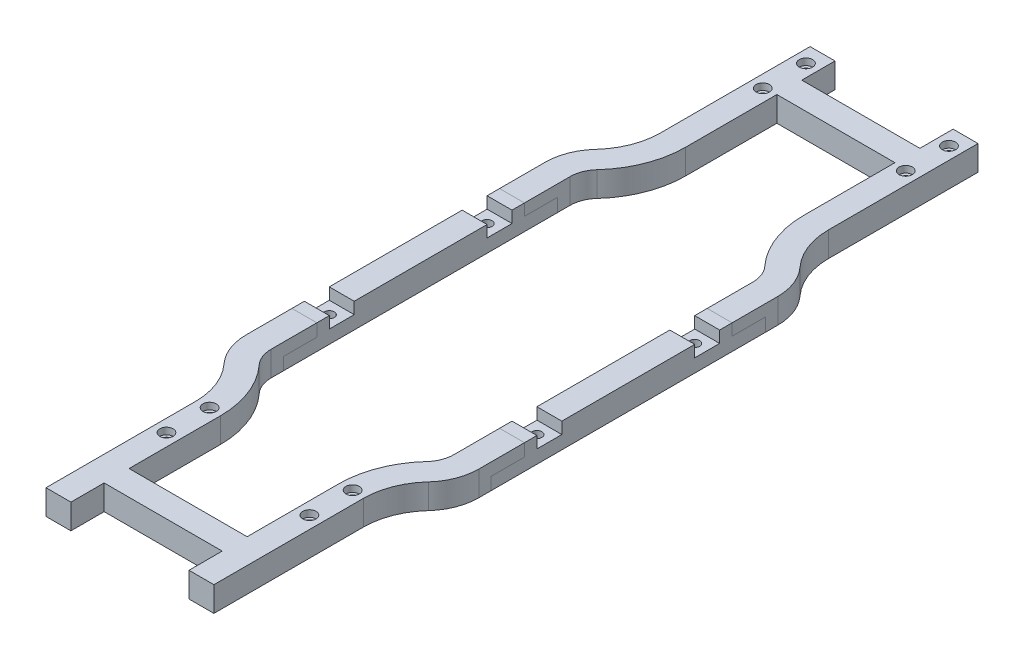
from build123d import *

# Parameters (mm, degrees)
SKETCH1_W                                  = 35.541770457
SKETCH1_H                                  = 15
BOSS_EXTRUDE1_DEPTH                        = 15
MIRROR2_AT_THE_SECOND_PLANE_COPY_1_SKETC_W = 35.541770457
MIRROR2_AT_THE_SECOND_PLANE_COPY_1_SKETC_H = 15
MIRROR2_AT_THE_SECOND_PLANE_COPY_1_DEPTH   = 15
CBORE_FOR_M4_SHCS1_D                       = 4.5
CBORE_FOR_M4_SHCS1_CBORE_D                 = 8
CBORE_FOR_M4_SHCS1_CBORE_DEPTH             = 4
SKETCH7_W                                  = 15
SKETCH7_H                                  = 15
CUT_EXTRUDE1_DEPTH                         = 7
SKETCH8_R                                  = 3
CUT_EXTRUDE2_DEPTH                         = 241.549371232
SPLIT1_START                               = -62.5
SPLIT1_OUTLINE_W                           = 140
SPLIT1_OUTLINE_H                           = 15
SPLIT1_DEPTH                               = 292.5
SPLIT1_START_2                             = -82.5
SPLIT1_2_OUTLINE_W                         = 15
SPLIT1_2_OUTLINE_H                         = 8
SPLIT1_2_DEPTH                             = 20
SPLIT1_3_OUTLINE_W                         = 15
SPLIT1_3_OUTLINE_H                         = 7.5
SPLIT1_3_OUTLINE_H_2                       = 80
SPLIT1_3_DEPTH                             = 15
SPLIT1_4_OUTLINE_W                         = 15
SPLIT1_4_OUTLINE_H                         = 20
SPLIT1_4_OUTLINE_H_2                       = 15
SPLIT1_4_OUTLINE_R                         = 3
SPLIT1_4_DEPTH                             = 7.5
SPLIT1_START_3                             = 7.5
SPLIT1_5_OUTLINE_W                         = 15
SPLIT1_5_OUTLINE_H                         = 20
SPLIT1_5_OUTLINE_H_2                       = 15
SPLIT1_5_OUTLINE_R                         = 3
SPLIT1_5_DEPTH                             = 0.5
SPLIT1_6_OUTLINE_W                         = 15
SPLIT1_6_OUTLINE_H                         = 7.5
SPLIT1_6_OUTLINE_H_2                       = 80
SPLIT1_6_DEPTH                             = 15
SPLIT1_7_OUTLINE_W                         = 15
SPLIT1_7_OUTLINE_H                         = 20
SPLIT1_7_OUTLINE_H_2                       = 15
SPLIT1_7_OUTLINE_R                         = 3
SPLIT1_7_DEPTH                             = 7.5
SPLIT1_8_OUTLINE_W                         = 15
SPLIT1_8_OUTLINE_H                         = 20
SPLIT1_8_OUTLINE_H_2                       = 15
SPLIT1_8_OUTLINE_R                         = 3
SPLIT1_8_DEPTH                             = 0.5
SPLIT1_9_OUTLINE_R                         = 4
SPLIT1_9_DEPTH                             = 15
SPLIT1_10_OUTLINE_W                        = 15
SPLIT1_10_OUTLINE_H                        = 20
SPLIT1_10_DEPTH                            = 7.5
SPLIT1_11_OUTLINE_R                        = 4
SPLIT1_11_OUTLINE_R_2                      = 2.25
SPLIT1_11_DEPTH                            = 11


# Read off the part's stored shape, not the designer's step: Split1
with BuildPart() as part:
    # Sketch1 → Boss-Extrude1 (new body)
    with BuildSketch(Plane(origin=(0, 0, 0), x_dir=(1, 0, 0), z_dir=(0, 1, 0))):
        with BuildLine():
            Line((-35.541770457, 230), (-35.541770457, 140))
            ThreePointArc((-35.541770457, 140), (-39.394799327, 119.475151066), (-50.429240982, 101.7450537))
            ThreePointArc((-50.429240982, 101.7450537), (-53.817041053, 96.301549897), (-55, 90))
            Line((-55, 90), (-55, 0))
            Line((-55, 0), (-70, 0))
            Line((-70, 0), (-70, 90))
            ThreePointArc((-70, 90), (-67.795808847, 101.741591346), (-61.48336752, 111.884397194))
            ThreePointArc((-61.48336752, 111.884397194), (-53.373567121, 124.915192515), (-50.541770457, 140))
            Line((-50.541770457, 140), (-50.541770457, 230))
            Line((-50.541770457, 230), (-35.541770457, 230))
        make_face()
        with Locations((-17.770885229, 202.5)):
            Rectangle(SKETCH1_W, SKETCH1_H)
    boss_extrude1 = extrude(amount=BOSS_EXTRUDE1_DEPTH)

    # Mirror2 at the second plane: Boss-Extrude1 across plane
    add(boss_extrude1.mirror(Plane.XY))



with BuildPart() as mirror2_1:
    # Mirror2: Boss-Extrude1 across plane
    add(boss_extrude1.mirror(Plane(origin=(0, 0, 0), x_dir=(0, 0, 1), z_dir=(1, 0, 0))))


with BuildPart() as part_1:
    add(part.part)

    add(mirror2_1.part)  # Mirror2 at the second plane copy 1 merges Mirror2_1
    # Mirror2 at the second plane copy 1 sketc → Mirror2 at the second plane copy 1 (add)
    with BuildSketch(Plane(origin=(0, 0, 0), x_dir=(-1, 0, 0), z_dir=(0, 1, 0))):
        with BuildLine():
            Line((-35.541770457, 230), (-35.541770457, 140))
            ThreePointArc((-35.541770457, 140), (-39.394799327, 119.475151066), (-50.429240982, 101.7450537))
            ThreePointArc((-50.429240982, 101.7450537), (-53.817041053, 96.301549897), (-55, 90))
            Line((-55, 90), (-55, 0))
            Line((-55, 0), (-70, 0))
            Line((-70, 0), (-70, 90))
            ThreePointArc((-70, 90), (-67.795808847, 101.741591346), (-61.48336752, 111.884397194))
            ThreePointArc((-61.48336752, 111.884397194), (-53.373567121, 124.915192515), (-50.541770457, 140))
            Line((-50.541770457, 140), (-50.541770457, 230))
            Line((-50.541770457, 230), (-35.541770457, 230))
        make_face()
        with Locations((-17.770885229, 202.5)):
            Rectangle(MIRROR2_AT_THE_SECOND_PLANE_COPY_1_SKETC_W, MIRROR2_AT_THE_SECOND_PLANE_COPY_1_SKETC_H)
    extrude(amount=MIRROR2_AT_THE_SECOND_PLANE_COPY_1_DEPTH)

    # CBORE for M4 SHCS1 (through all)
    with Locations(Plane(origin=(0, 15, 0), x_dir=(1, 0, 0), z_dir=(0, 1, 0))):
        with Locations((-43.041770457, 220), (-43.041770457, 194), (-43.041770457, -139), (-43.041770457, -165)):
            cbore_for_m4_shcs1 = CounterBoreHole(CBORE_FOR_M4_SHCS1_D / 2, CBORE_FOR_M4_SHCS1_CBORE_D / 2, CBORE_FOR_M4_SHCS1_CBORE_DEPTH)

    # Mirror3: CBORE for M4 SHCS1 across plane
    add(cbore_for_m4_shcs1.mirror(Plane(origin=(0, 0, 0), x_dir=(0, 0, 1), z_dir=(1, 0, 0))), mode=Mode.SUBTRACT)

    # Sketch7 → Cut-Extrude1 (cut)
    with BuildSketch(Plane(origin=(0, 15, 0), x_dir=(1, 0, 0), z_dir=(0, 1, 0))):
        with Locations((-62.5, 47.5)):
            Rectangle(SKETCH7_W, SKETCH7_H)
        with Locations((-62.5, -47.5)):
            Rectangle(SKETCH7_W, SKETCH7_H)
    cut_extrude1 = extrude(amount=-CUT_EXTRUDE1_DEPTH, mode=Mode.SUBTRACT)

    # Sketch8 → Cut-Extrude2 (cut, through all)
    with BuildSketch(Plane(origin=(0, 8, 0), x_dir=(1, 0, 0), z_dir=(0, 1, 0))):
        with Locations(Location((-62.5, 47.5, 0), (0, 0, 270))):
            Circle(SKETCH8_R)
        with Locations(Location((-62.5, -47.5, 0), (0, 0, 270))):
            Circle(SKETCH8_R)
    cut_extrude2 = extrude(amount=-CUT_EXTRUDE2_DEPTH, mode=Mode.SUBTRACT)

    # Mirror4: Cut-Extrude1, Cut-Extrude2 across plane
    add(cut_extrude1.mirror(Plane(origin=(0, 0, 0), x_dir=(0, 0, 1), z_dir=(1, 0, 0))), mode=Mode.SUBTRACT)
    add(cut_extrude2.mirror(Plane(origin=(0, 0, 0), x_dir=(0, 0, 1), z_dir=(1, 0, 0))), mode=Mode.SUBTRACT)

    # Split1 outline → Split1 (cut)
    with BuildSketch(Plane.XY.offset(SPLIT1_START)):
        with Locations((0, 7.5)):
            Rectangle(SPLIT1_OUTLINE_W, SPLIT1_OUTLINE_H)
    extrude(amount=SPLIT1_DEPTH, mode=Mode.SUBTRACT)

    # Split1 2 outline → Split1 2 (cut)
    with BuildSketch(Plane.XY.offset(SPLIT1_START_2)):
        with Locations((62.5, 4)):
            Rectangle(SPLIT1_2_OUTLINE_W, SPLIT1_2_OUTLINE_H)
        with Locations((-62.5, 4)):
            Rectangle(SPLIT1_2_OUTLINE_W, SPLIT1_2_OUTLINE_H)
    extrude(amount=SPLIT1_2_DEPTH, mode=Mode.SUBTRACT)


with BuildPart() as body_2:
    # Split1 3 outline → Split1 3 (new body)
    with BuildSketch(Plane(origin=(0, 0, 0), x_dir=(1, 0, 0), z_dir=(0, 1, 0))):
        with Locations((62.5, 58.75)):
            Rectangle(SPLIT1_3_OUTLINE_W, SPLIT1_3_OUTLINE_H)
        with Locations((62.5, 0)):
            Rectangle(SPLIT1_3_OUTLINE_W, SPLIT1_3_OUTLINE_H_2)
        with Locations((62.5, -58.75)):
            Rectangle(SPLIT1_3_OUTLINE_W, SPLIT1_3_OUTLINE_H)
    extrude(amount=SPLIT1_3_DEPTH)

    # Split1 4 outline → Split1 4 (add)
    # profile 1 of 4: a face of its own
    with BuildSketch(Plane(origin=(0, 0, 0), x_dir=(1, 0, 0), z_dir=(0, 1, 0))):
        with Locations((62.5, 72.5)):
            Rectangle(SPLIT1_4_OUTLINE_W, SPLIT1_4_OUTLINE_H)
    # profile 2 of 4: a face of its own
    with BuildSketch(Plane(origin=(0, 0, 0), x_dir=(1, 0, 0), z_dir=(0, 1, 0))):
        with Locations((62.5, 47.5)):
            Rectangle(SPLIT1_4_OUTLINE_W, SPLIT1_4_OUTLINE_H_2)
        with Locations((62.5, 47.5)):
            Circle(SPLIT1_4_OUTLINE_R, mode=Mode.SUBTRACT)
    # profile 3 of 4: a face of its own
    with BuildSketch(Plane(origin=(0, 0, 0), x_dir=(1, 0, 0), z_dir=(0, 1, 0))):
        with Locations((62.5, -47.5)):
            Rectangle(SPLIT1_4_OUTLINE_W, SPLIT1_4_OUTLINE_H_2)
        with Locations((62.5, -47.5)):
            Circle(SPLIT1_4_OUTLINE_R, mode=Mode.SUBTRACT)
    # profile 4 of 4: a face of its own
    with BuildSketch(Plane(origin=(0, 0, 0), x_dir=(1, 0, 0), z_dir=(0, 1, 0))):
        with Locations((62.5, -72.5)):
            Rectangle(SPLIT1_4_OUTLINE_W, SPLIT1_4_OUTLINE_H)
    extrude(amount=SPLIT1_4_DEPTH)

    # Split1 5 outline → Split1 5 (add)
    # profile 1 of 3: a face of its own
    with BuildSketch(Plane(origin=(0, 0, 0), x_dir=(1, 0, 0), z_dir=(0, 1, 0)).offset(SPLIT1_START_3)):
        with Locations((62.5, 72.5)):
            Rectangle(SPLIT1_5_OUTLINE_W, SPLIT1_5_OUTLINE_H)
    # profile 2 of 3: a face of its own
    with BuildSketch(Plane(origin=(0, 0, 0), x_dir=(1, 0, 0), z_dir=(0, 1, 0)).offset(SPLIT1_START_3)):
        with Locations((62.5, 47.5)):
            Rectangle(SPLIT1_5_OUTLINE_W, SPLIT1_5_OUTLINE_H_2)
        with Locations((62.5, 47.5)):
            Circle(SPLIT1_5_OUTLINE_R, mode=Mode.SUBTRACT)
    # profile 3 of 3: a face of its own
    with BuildSketch(Plane(origin=(0, 0, 0), x_dir=(1, 0, 0), z_dir=(0, 1, 0)).offset(SPLIT1_START_3)):
        with Locations((62.5, -47.5)):
            Rectangle(SPLIT1_5_OUTLINE_W, SPLIT1_5_OUTLINE_H_2)
        with Locations((62.5, -47.5)):
            Circle(SPLIT1_5_OUTLINE_R, mode=Mode.SUBTRACT)
    extrude(amount=SPLIT1_5_DEPTH)


with BuildPart() as body_3:
    # Split1 6 outline → Split1 6 (new body)
    with BuildSketch(Plane(origin=(0, 0, 0), x_dir=(1, 0, 0), z_dir=(0, 1, 0))):
        with Locations((-62.5, 58.75)):
            Rectangle(SPLIT1_6_OUTLINE_W, SPLIT1_6_OUTLINE_H)
        with Locations((-62.5, 0)):
            Rectangle(SPLIT1_6_OUTLINE_W, SPLIT1_6_OUTLINE_H_2)
        with Locations((-62.5, -58.75)):
            Rectangle(SPLIT1_6_OUTLINE_W, SPLIT1_6_OUTLINE_H)
    extrude(amount=SPLIT1_6_DEPTH)

    # Split1 7 outline → Split1 7 (add)
    # profile 1 of 4: a face of its own
    with BuildSketch(Plane(origin=(0, 0, 0), x_dir=(1, 0, 0), z_dir=(0, 1, 0))):
        with Locations((-62.5, 72.5)):
            Rectangle(SPLIT1_7_OUTLINE_W, SPLIT1_7_OUTLINE_H)
    # profile 2 of 4: a face of its own
    with BuildSketch(Plane(origin=(0, 0, 0), x_dir=(1, 0, 0), z_dir=(0, 1, 0))):
        with Locations((-62.5, 47.5)):
            Rectangle(SPLIT1_7_OUTLINE_W, SPLIT1_7_OUTLINE_H_2)
        with Locations((-62.5, 47.5)):
            Circle(SPLIT1_7_OUTLINE_R, mode=Mode.SUBTRACT)
    # profile 3 of 4: a face of its own
    with BuildSketch(Plane(origin=(0, 0, 0), x_dir=(1, 0, 0), z_dir=(0, 1, 0))):
        with Locations((-62.5, -47.5)):
            Rectangle(SPLIT1_7_OUTLINE_W, SPLIT1_7_OUTLINE_H_2)
        with Locations((-62.5, -47.5)):
            Circle(SPLIT1_7_OUTLINE_R, mode=Mode.SUBTRACT)
    # profile 4 of 4: a face of its own
    with BuildSketch(Plane(origin=(0, 0, 0), x_dir=(1, 0, 0), z_dir=(0, 1, 0))):
        with Locations((-62.5, -72.5)):
            Rectangle(SPLIT1_7_OUTLINE_W, SPLIT1_7_OUTLINE_H)
    extrude(amount=SPLIT1_7_DEPTH)

    # Split1 8 outline → Split1 8 (add)
    # profile 1 of 3: a face of its own
    with BuildSketch(Plane(origin=(0, 0, 0), x_dir=(1, 0, 0), z_dir=(0, 1, 0)).offset(SPLIT1_START_3)):
        with Locations((-62.5, 72.5)):
            Rectangle(SPLIT1_8_OUTLINE_W, SPLIT1_8_OUTLINE_H)
    # profile 2 of 3: a face of its own
    with BuildSketch(Plane(origin=(0, 0, 0), x_dir=(1, 0, 0), z_dir=(0, 1, 0)).offset(SPLIT1_START_3)):
        with Locations((-62.5, 47.5)):
            Rectangle(SPLIT1_8_OUTLINE_W, SPLIT1_8_OUTLINE_H_2)
        with Locations((-62.5, 47.5)):
            Circle(SPLIT1_8_OUTLINE_R, mode=Mode.SUBTRACT)
    # profile 3 of 3: a face of its own
    with BuildSketch(Plane(origin=(0, 0, 0), x_dir=(1, 0, 0), z_dir=(0, 1, 0)).offset(SPLIT1_START_3)):
        with Locations((-62.5, -47.5)):
            Rectangle(SPLIT1_8_OUTLINE_W, SPLIT1_8_OUTLINE_H_2)
        with Locations((-62.5, -47.5)):
            Circle(SPLIT1_8_OUTLINE_R, mode=Mode.SUBTRACT)
    extrude(amount=SPLIT1_8_DEPTH)


with BuildPart() as body_4:
    # Split1 9 outline → Split1 9 (new body)
    with BuildSketch(Plane(origin=(0, 0, 0), x_dir=(1, 0, 0), z_dir=(0, 1, 0))):
        with BuildLine():
            Line((70, -82.5), (55, -82.5))
            Line((55, -82.5), (55, -90))
            ThreePointArc((55, -90), (53.817041053, -96.301549897), (50.429240982, -101.7450537))
            ThreePointArc((50.429240982, -101.7450537), (39.394799327, -119.475151066), (35.541770457, -140))
            Line((35.541770457, -140), (35.541770457, -195))
            Line((35.541770457, -195), (-35.541770457, -195))
            Line((-35.541770457, -195), (-35.541770457, -140))
            ThreePointArc((-35.541770457, -140), (-39.394799327, -119.475151066), (-50.429240982, -101.7450537))
            ThreePointArc((-50.429240982, -101.7450537), (-53.817041053, -96.301549897), (-55, -90))
            Line((-55, -90), (-55, -82.5))
            Line((-55, -82.5), (-70, -82.5))
            Line((-70, -82.5), (-70, -90))
            ThreePointArc((-70, -90), (-67.795808847, -101.741591346), (-61.48336752, -111.884397194))
            ThreePointArc((-61.48336752, -111.884397194), (-53.373567121, -124.915192515), (-50.541770457, -140))
            Line((-50.541770457, -140), (-50.541770457, -230))
            Line((-50.541770457, -230), (-35.541770457, -230))
            Line((-35.541770457, -230), (-35.541770457, -210))
            Line((-35.541770457, -210), (35.541770457, -210))
            Line((35.541770457, -210), (35.541770457, -230))
            Line((35.541770457, -230), (50.541770457, -230))
            Line((50.541770457, -230), (50.541770457, -140))
            ThreePointArc((50.541770457, -140), (53.373567121, -124.915192515), (61.48336752, -111.884397194))
            ThreePointArc((61.48336752, -111.884397194), (67.795808847, -101.741591346), (70, -90))
            Line((70, -90), (70, -82.5))
        make_face()
        with Locations((-43.041770457, -165)):
            Circle(SPLIT1_9_OUTLINE_R, mode=Mode.SUBTRACT)
        with Locations((43.041770457, -165)):
            Circle(SPLIT1_9_OUTLINE_R, mode=Mode.SUBTRACT)
        with Locations((-43.041770457, -139)):
            Circle(SPLIT1_9_OUTLINE_R, mode=Mode.SUBTRACT)
        with Locations((43.041770457, -139)):
            Circle(SPLIT1_9_OUTLINE_R, mode=Mode.SUBTRACT)
    extrude(amount=SPLIT1_9_DEPTH)

    # Split1 10 outline → Split1 10 (add)
    with BuildSketch(Plane(origin=(0, 0, 0), x_dir=(1, 0, 0), z_dir=(0, 1, 0)).offset(SPLIT1_START_3)):
        with Locations((62.5, -72.5)):
            Rectangle(SPLIT1_10_OUTLINE_W, SPLIT1_10_OUTLINE_H)
        with Locations((-62.5, -72.5)):
            Rectangle(SPLIT1_10_OUTLINE_W, SPLIT1_10_OUTLINE_H)
    extrude(amount=SPLIT1_10_DEPTH)

    # Split1 11 outline → Split1 11 (add)
    # profile 1 of 4: a face of its own
    with BuildSketch(Plane(origin=(0, 0, 0), x_dir=(1, 0, 0), z_dir=(0, 1, 0))):
        with Locations((43.041770457, -139)):
            Circle(SPLIT1_11_OUTLINE_R)
        with Locations((43.041770457, -139)):
            Circle(SPLIT1_11_OUTLINE_R_2, mode=Mode.SUBTRACT)
    # profile 2 of 4: a face of its own
    with BuildSketch(Plane(origin=(0, 0, 0), x_dir=(1, 0, 0), z_dir=(0, 1, 0))):
        with Locations((-43.041770457, -165)):
            Circle(SPLIT1_11_OUTLINE_R)
        with Locations((-43.041770457, -165)):
            Circle(SPLIT1_11_OUTLINE_R_2, mode=Mode.SUBTRACT)
    # profile 3 of 4: a face of its own
    with BuildSketch(Plane(origin=(0, 0, 0), x_dir=(1, 0, 0), z_dir=(0, 1, 0))):
        with Locations((-43.041770457, -139)):
            Circle(SPLIT1_11_OUTLINE_R)
        with Locations((-43.041770457, -139)):
            Circle(SPLIT1_11_OUTLINE_R_2, mode=Mode.SUBTRACT)
    # profile 4 of 4: a face of its own
    with BuildSketch(Plane(origin=(0, 0, 0), x_dir=(1, 0, 0), z_dir=(0, 1, 0))):
        with Locations((43.041770457, -165)):
            Circle(SPLIT1_11_OUTLINE_R)
        with Locations((43.041770457, -165)):
            Circle(SPLIT1_11_OUTLINE_R_2, mode=Mode.SUBTRACT)
    extrude(amount=SPLIT1_11_DEPTH)


solid = Compound([part_1.part, body_2.part, body_3.part, body_4.part])
